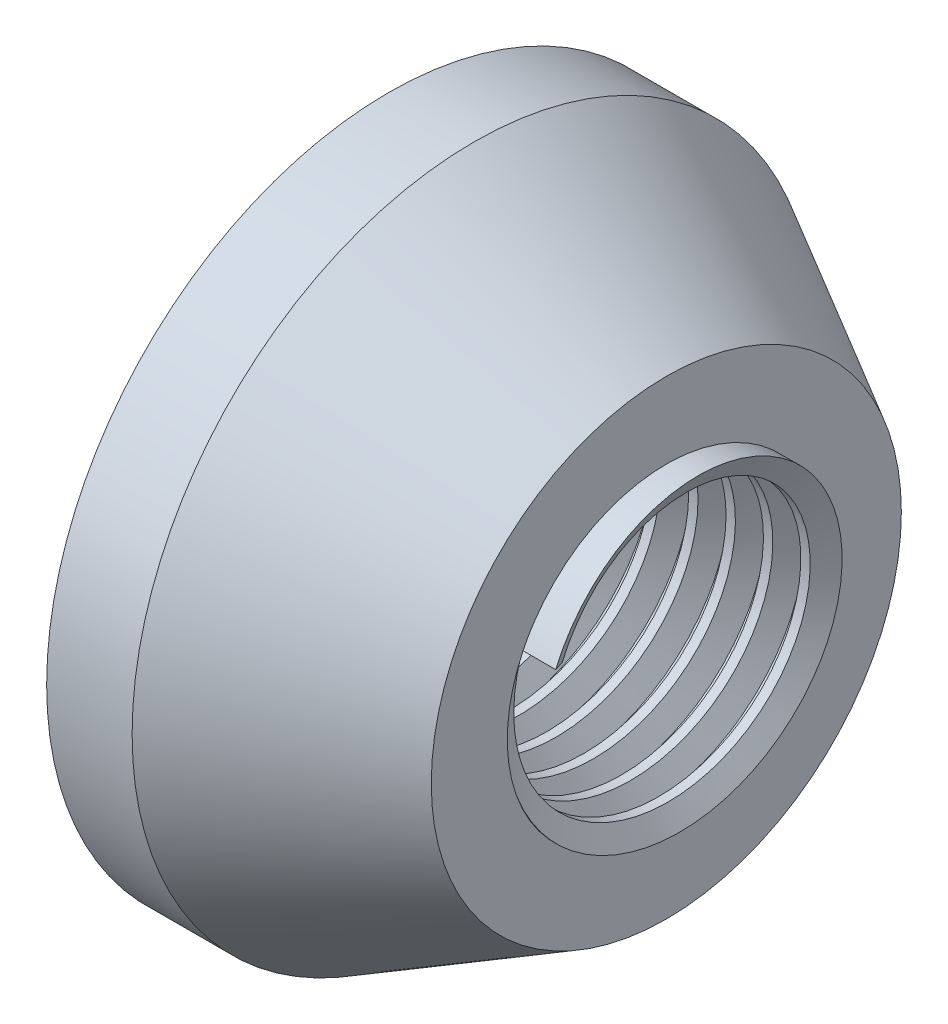
from build123d import *

# Parameters (mm, degrees)
THREAD1_PITCH = 1.75


with BuildPart() as part:
    # Sketch1 → Revolve1 (revolve)
    with BuildSketch(Plane.XY, mode=Mode.PRIVATE) as revolve1_sk:
        Polygon((-4.097164197, 7.44122729), (-4.097164197, 16), (-0.097164197, 16), (8.902835803, 11), (8.902835803, 7.44122729), align=None)
    revolve(revolve1_sk.sketch.rotate(Axis((19.08385955, 0, 0), (-1, 0, 0)), 90), axis=Axis((19.08385955, 0, 0), (-1, 0, 0)))

    # Thread1: the profile of Thread Profile1 profile screwed along a right-hand helix of 7.428571 turns, 10 arcs to a turn; built about Z, then put on its axis
    thread1_z = Axis((0, 0, 0), (0, 0, 1))
    thread1_corners = [(7.44152729, 0, -0.000173205), (7.44152729, 0, 1.531423201), (6.494012008, 0, 0.984374998), (6.494012008, 0, 0.546874998)]
    with BuildLine(mode=Mode.PRIVATE) as thread1_profile:
        Line(thread1_corners[0], thread1_corners[1])
        Line(thread1_corners[1], thread1_corners[2])
        Line(thread1_corners[2], thread1_corners[3])
        Line(thread1_corners[3], thread1_corners[0])
    thread1_cap = Face(thread1_profile.wire())
    thread1_turn_angles = [0, 18, 36, 54, 72, 90, 108, 126, 144, 162, 180, 198, 216, 234, 252, 270, 288, 306, 324, 342, 360]
    thread1_turn_weights = [1, 0.9510565162951535, 1, 0.9510565162951535, 1, 0.9510565162951535, 1, 0.9510565162951535, 1, 0.9510565162951535, 1, 0.9510565162951535, 1, 0.9510565162951535, 1, 0.9510565162951535, 1, 0.9510565162951535, 1, 0.9510565162951535, 1]
    thread1_turn_rails = [Edge.make_bspline([Vector(p[0], p[1], 0).rotate(thread1_z, thread1_turn_angles[k]) / thread1_turn_weights[k] + Vector(0, 0, p[2] + THREAD1_PITCH * thread1_turn_angles[k] / 360) for k in range(21)], [0, 0, 0, 1, 1, 2, 2, 3, 3, 4, 4, 5, 5, 6, 6, 7, 7, 8, 8, 9, 9, 10, 10, 10], 2, thread1_turn_weights) for p in thread1_corners]
    thread1_turn_sides = [Face.make_surface_from_curves(thread1_turn_rails[p[0]], thread1_turn_rails[p[1]]) for p in [(0, 1), (1, 2), (2, 3), (3, 0)]]
    thread1_last_angles = [2520, 2538, 2556, 2574, 2592, 2610, 2628, 2646, 2664, 2669.142857143, 2674.285714286]
    thread1_last_weights = [1, 0.9510565162951535, 1, 0.9510565162951535, 1, 0.9510565162951535, 1, 0.9510565162951535, 1, 0.9959742939952391, 1]
    thread1_last_rails = [Edge.make_bspline([Vector(p[0], p[1], 0).rotate(thread1_z, thread1_last_angles[k]) / thread1_last_weights[k] + Vector(0, 0, p[2] + THREAD1_PITCH * thread1_last_angles[k] / 360) for k in range(11)], [0, 0, 0, 1, 1, 2, 2, 3, 3, 4, 4, 5, 5, 5], 2, thread1_last_weights) for p in thread1_corners]
    thread1_last_sides = [Face.make_surface_from_curves(thread1_last_rails[p[0]], thread1_last_rails[p[1]]) for p in [(0, 1), (1, 2), (2, 3), (3, 0)]]
    thread1 = Plane(origin=(-4.097164197, 0, 0), x_dir=(0, 0, -1), z_dir=(1, 0, 0)) * Solid(Shell([*[p.moved(Location((0, 0, THREAD1_PITCH * i))) for i in range(7) for p in thread1_turn_sides], *thread1_last_sides, thread1_cap, thread1_cap.rotate(thread1_z, 2674.285714286).moved(Location((0, 0, THREAD1_PITCH * 2674.285714286 / 360)))]))
    add(thread1)


solid = part.part
